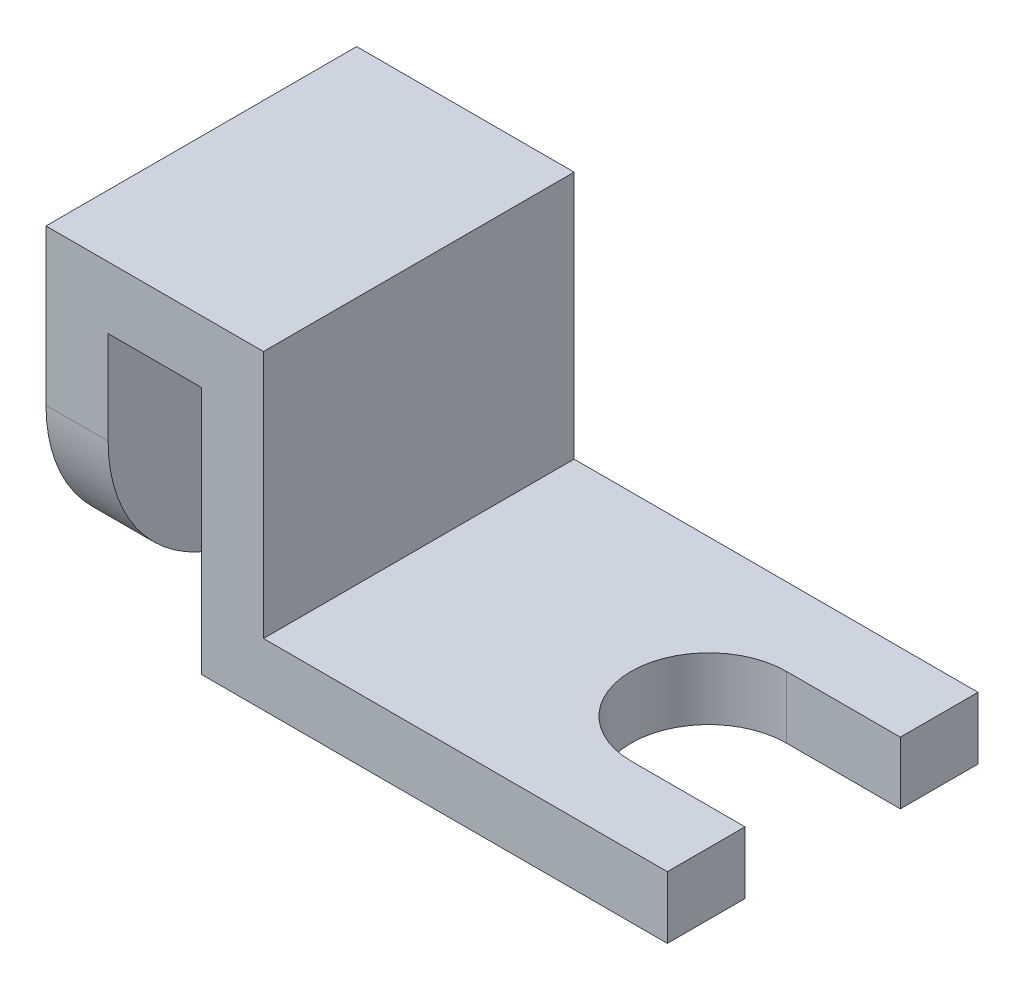
from build123d import *

# Parameters (mm, degrees)
SKETCH_1_W          = 6
SKETCH_1_H          = 24
SKETCH_1_W_2        = 45
SKETCH_1_H_2        = 6
EXTRUDE_1_DEPTH     = 30
FILLET_1_R          = 15
CUT_EXTRUDE_1_REACH = 74.312
SKETCH_2_R          = 6
CUT_EXTRUDE_2_DEPTH = 54.686590505


with BuildPart() as part:
    # Эскиз1 → Бобышка-Вытянуть1 (new body)
    with BuildSketch(Plane.XY):
        with Locations((-34.5, 9)):
            Rectangle(SKETCH_1_W, SKETCH_1_H)
        Polygon((-31.5, 21), (-22.5, 21), (-22.5, 27), (-37.5, 27), (-37.5, 21), align=None)
        Polygon((-22.5, 21), (-22.5, 3), (-16.5, 3), (-16.5, 27), (-22.5, 27), align=None)
        Rectangle(SKETCH_1_W_2, SKETCH_1_H_2)
    extrude(amount=EXTRUDE_1_DEPTH)

    # Скругление1
    fillet_1_edges = [part.edges().sort_by_distance(p)[0] for p in [
        (-34.5, -3, 0),
        (-34.5, -3, 30),
    ]]
    fillet(fillet_1_edges, radius=FILLET_1_R - 0.0001)  # a hair under: the kernel refuses the full size

    # Эскиз2 → Вырез-Вытянуть1 (cut, up to next)
    with BuildSketch(Plane.ZY.offset(37.5), mode=Mode.PRIVATE) as cut_extrude_1_sk1:
        with Locations((15, 12)):
            Circle(SKETCH_2_R)
    cut_extrude_1_tool1 = extrude(cut_extrude_1_sk1.sketch, amount=-CUT_EXTRUDE_1_REACH, mode=Mode.PRIVATE) & part.part
    add(cut_extrude_1_tool1.solids().sort_by_distance((-37.5, 12, 15))[0], mode=Mode.SUBTRACT)

    # Эскиз3 → Вырез-Вытянуть2 (cut, through all)
    with BuildSketch(Plane(origin=(0, 3, 0), x_dir=(1, 0, 0), z_dir=(0, 1, 0))):
        with BuildLine():
            Line((22.5, -7.5), (11.5, -7.5))
            ThreePointArc((11.5, -7.5), (4, -15), (11.5, -22.5))
            Line((11.5, -22.5), (22.5, -22.5))
            Line((22.5, -22.5), (22.5, -7.5))
        make_face()
    extrude(amount=-CUT_EXTRUDE_2_DEPTH, mode=Mode.SUBTRACT)


solid = part.part
